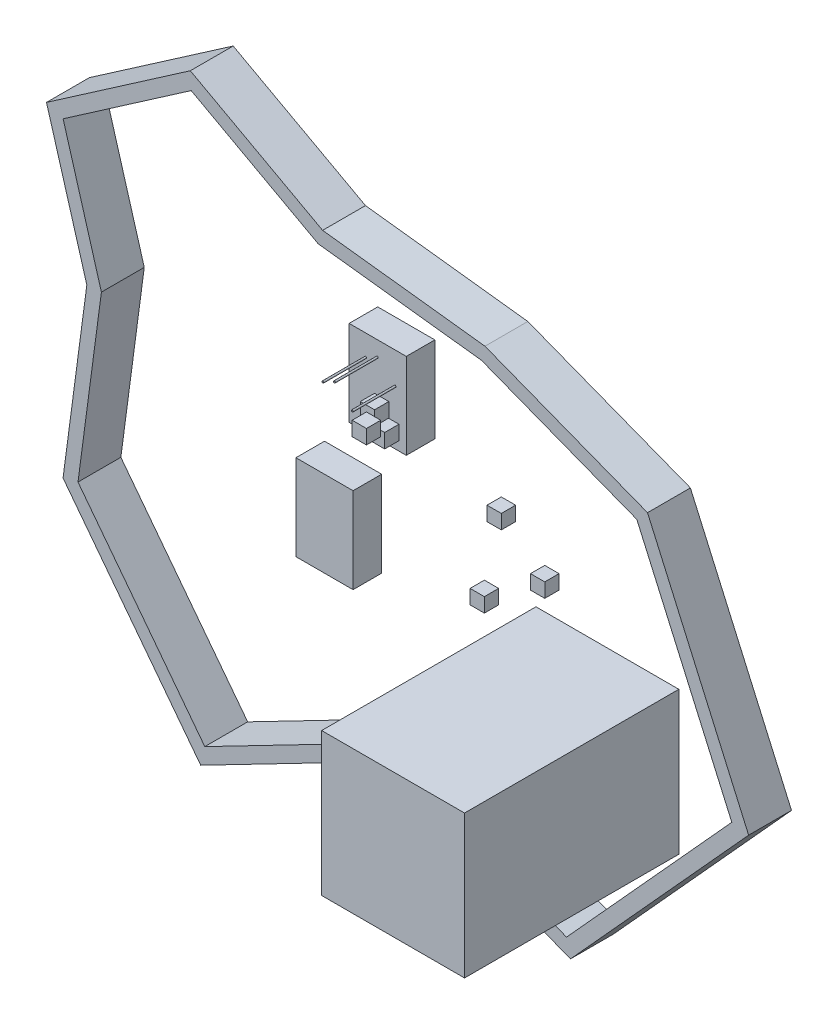
from build123d import *

# Parameters (mm, degrees)
SKETCH2_W                 = 5.08
SKETCH2_H                 = 15.24
SKETCH4_W                 = 20.32
SKETCH4_H                 = 30.48
BOSS_EXTRUDE2_DEPTH       = 10.16
BOSS_EXTRUDE2_2_DEPTH     = 10.16
SKETCH8_W                 = 5.08
SKETCH8_H                 = 5.08
BOSS_EXTRUDE3_DEPTH       = 5.08
BOSS_EXTRUDE3_2_DEPTH     = 5.08
BOSS_EXTRUDE3_3_DEPTH     = 5.08
SKETCH9_R                 = 0.3175
BOSS_EXTRUDE4_DEPTH       = 15.24
BOSS_EXTRUDE5_START       = -50.35078241
BOSS_EXTRUDE5_OUTLINE_W   = 5.08
BOSS_EXTRUDE5_OUTLINE_H   = 5.08
BOSS_EXTRUDE5_DEPTH       = 5.08
BOSS_EXTRUDE5_START_2     = -46.760051942
BOSS_EXTRUDE5_2_OUTLINE_W = 5.08
BOSS_EXTRUDE5_2_OUTLINE_H = 5.08
BOSS_EXTRUDE5_2_DEPTH     = 5.08
SKETCH11_W                = 5.08
SKETCH11_H                = 5.08
BOSS_EXTRUDE6_DEPTH       = 5.08
SKETCH12_W                = 50.8
SKETCH12_H                = 50.8
BOSS_EXTRUDE7_DEPTH       = 76.2
SKETCH13_W                = 2.320192308
SKETCH13_H                = 0.284935898
BOSS_EXTRUDE8_DEPTH       = 2.54


# Read off the part's stored shape, not the designer's step: Boss-Extrude5
with BuildPart() as part:
    # Sweep1: sweep along a path in Sketch1
    with BuildLine(Plane.XY) as sweep1_path:
        Line((-7.257050217, 67.127714508), (47.977165324, 45.759733313))
        Line((47.977165324, 45.759733313), (81.742952966, -30.615262543))
        Line((81.742952966, -30.615262543), (22.980659021, -95.349576464))
        Line((22.980659021, -95.349576464), (-44.345800205, -69.30357399))
        Line((-44.345800205, -69.30357399), (-105.630397604, -100.993948855))
        Line((-105.630397604, -100.993948855), (-150.720654377, -42.085618555))
        Line((-150.720654377, -42.085618555), (-142.397147653, 20.559361376))
        Line((-142.397147653, 20.559361376), (-156.00922127, 67.127714508))
        Line((-156.00922127, 67.127714508), (-110.468431083, 98.574932116))
        Line((-110.468431083, 98.574932116), (-65.313451954, 73.981595269))
        Line((-65.313451954, 73.981595269), (-7.257050217, 67.127714508))
    # Sketch2 → Sweep1 (sweep)
    with BuildSketch(Plane(origin=(22.980659021, -95.349576464, 0), x_dir=(-0.7404356459239746, 0.6721272604538121, 0), z_dir=(-0.6721272604538121, -0.7404356459239746, 0))):
        with Locations((-2.54, -7.62)):
            Rectangle(SKETCH2_W, SKETCH2_H)
    sweep(path=sweep1_path.line, transition=Transition.RIGHT)


with BuildPart() as body_2:
    # Sketch4 → Boss-Extrude2 (new body)
    with BuildSketch(Plane.XY):
        with Locations((-49.234960183, 34.655005926)):
            Rectangle(SKETCH4_W, SKETCH4_H)
    extrude(amount=BOSS_EXTRUDE2_DEPTH)

    # Sketch9 → Boss-Extrude4 (add)
    with BuildSketch(Plane.XY.offset(10.16)):
        with Locations(Location((-53.524881213, 42.375280418, 0), (0, 0, 180))):
            Circle(SKETCH9_R)
        with Locations(Location((-49.395083843, 44.483621336, 0), (0, 0, 180))):
            Circle(SKETCH9_R)
        with Locations(Location((-43.028697146, 38.734466137, 0), (0, 0, 180))):
            Circle(SKETCH9_R)
    extrude(amount=BOSS_EXTRUDE4_DEPTH)

    # Boss-Extrude5 outline → Boss-Extrude5 (add)
    with BuildSketch(Plane.YZ.offset(BOSS_EXTRUDE5_START)):
        with Locations((30.355657961, 12.7)):
            Rectangle(BOSS_EXTRUDE5_OUTLINE_W, BOSS_EXTRUDE5_OUTLINE_H)
    extrude(amount=BOSS_EXTRUDE5_DEPTH)

    # Boss-Extrude5 2 outline → Boss-Extrude5 2 (add)
    with BuildSketch(Plane.YZ.offset(BOSS_EXTRUDE5_START_2)):
        with Locations((25.162270308, 12.7)):
            Rectangle(BOSS_EXTRUDE5_2_OUTLINE_W, BOSS_EXTRUDE5_2_OUTLINE_H)
    extrude(amount=BOSS_EXTRUDE5_2_DEPTH)

    # Sketch11 → Boss-Extrude6 (add)
    with BuildSketch(Plane.XY.offset(15.24)):
        with Locations((-45.619537146, 28.235790272)):
            Rectangle(SKETCH11_W, SKETCH11_H)
    extrude(amount=BOSS_EXTRUDE6_DEPTH)


with BuildPart() as body_3:
    # Sketch4 → Boss-Extrude2 2 (new body)
    with BuildSketch(Plane.XY):
        with Locations((-68.156587581, -16.164579556)):
            Rectangle(SKETCH4_W, SKETCH4_H)
    extrude(amount=BOSS_EXTRUDE2_2_DEPTH)


with BuildPart() as body_4:
    # Sketch8 → Boss-Extrude3 (new body)
    with BuildSketch(Plane.XY):
        with Locations((-12.912976789, 10.811567101)):
            Rectangle(SKETCH8_W, SKETCH8_H)
    extrude(amount=BOSS_EXTRUDE3_DEPTH)


with BuildPart() as body_5:
    # Sketch8 → Boss-Extrude3 2 (new body)
    with BuildSketch(Plane.XY):
        with Locations((2.54, -2.54)):
            Rectangle(SKETCH8_W, SKETCH8_H)
    extrude(amount=BOSS_EXTRUDE3_2_DEPTH)


with BuildPart() as body_6:
    # Sketch8 → Boss-Extrude3 3 (new body)
    with BuildSketch(Plane.XY):
        with Locations((-18.931814109, -17.821007752)):
            Rectangle(SKETCH8_W, SKETCH8_H)
    extrude(amount=BOSS_EXTRUDE3_3_DEPTH)


with BuildPart() as body_7:
    # Sketch12 → Boss-Extrude7 (new body)
    with BuildSketch(Plane.XY):
        with Locations((22.274783409, -39.712298072)):
            Rectangle(SKETCH12_W, SKETCH12_H)
    extrude(amount=BOSS_EXTRUDE7_DEPTH)

    # Sketch13 → Boss-Extrude8 (add)
    # profile 1 of 13: a face of its own
    with BuildSketch(Plane.ZY.offset(3.125216591)):
        with BuildLine():
            Line((52.77321562, -22.209717114), (52.77321562, -22.494653012))
            Line((52.77321562, -22.494653012), (52.369980444, -22.494653012))
            add(Edge.make_bspline(
                [(52.369980444, -22.494653012), (52.405204861, -22.520366248), (52.472583865, -22.569551796), (52.562362323, -22.649432973), (52.637300451, -22.730607346), (52.677154282, -22.788654223), (52.696257487, -22.816477931)],
                knots=[0, 0, 0, 0, 1.134266299, 2.169680534, 3.122669868, 4, 4, 4, 4], degree=3))
            add(Edge.make_bspline(
                [(52.696257487, -22.816477931), (52.714405211, -22.854455161), (52.750383598, -22.929746113), (52.786881183, -23.048962124), (52.809310382, -23.17094986), (52.812377771, -23.253325882), (52.813920748, -23.294763188)],
                knots=[0, 0, 0, 0, 1.014936303, 2.012140481, 3.000054389, 4, 4, 4, 4], degree=3))
            add(Edge.make_bspline(
                [(52.813920748, -23.294763188), (52.812970004, -23.322786528), (52.811088532, -23.378243212), (52.798915092, -23.460430823), (52.777619253, -23.540266697), (52.748708632, -23.617232973), (52.712577896, -23.68930753), (52.671031725, -23.755508871), (52.624102768, -23.815024066), (52.5699739, -23.867756707), (52.507073314, -23.915171048), (52.433718618, -23.958785777), (52.348258589, -23.999085686), (52.286240403, -24.021420746), (52.253589218, -24.033179654)],
                knots=[0, 0, 0, 0, 1.009798505, 1.998336943, 2.985959917, 3.981996858, 4.955664737, 5.886087062, 6.794002107, 7.679958053, 8.601272429, 9.625787331, 10.750030247, 12, 12, 12, 12], degree=3))
            add(Edge.make_bspline(
                [(52.253589218, -24.033179654), (52.276017798, -24.045617718), (52.320154094, -24.070094081), (52.382618379, -24.111192764), (52.441044524, -24.154252842), (52.495478979, -24.199641256), (52.545652606, -24.247197916), (52.591732469, -24.297146215), (52.633912149, -24.349203353), (52.683203918, -24.421581732), (52.735356065, -24.51561456), (52.781160751, -24.634204569), (52.808878193, -24.757812866), (52.812231565, -24.841843013), (52.813920748, -24.884171241)],
                knots=[0, 0, 0, 0, 0.861170869, 1.694663331, 2.509326413, 3.297991968, 4.073691563, 4.829592376, 5.579160782, 6.321830913, 7.768780219, 9.179854006, 10.579417172, 12, 12, 12, 12], degree=3))
            add(Edge.make_bspline(
                [(52.813920748, -24.884171241), (52.812453698, -24.923070853), (52.809582538, -24.999201172), (52.787036887, -25.110033406), (52.748322164, -25.213394901), (52.695495937, -25.309077677), (52.629111964, -25.395401222), (52.550128089, -25.470436731), (52.459102996, -25.533728418), (52.373475977, -25.575074756), (52.297878925, -25.603119317), (52.233466075, -25.620410579), (52.162571452, -25.635686588), (52.085110287, -25.648369575), (52.000808949, -25.657639262), (51.909805397, -25.664506982), (51.812028903, -25.669155249), (51.744568771, -25.6694837), (51.709794146, -25.669653012)],
                knots=[0, 0, 0, 0, 1.209669288, 2.367440248, 3.500751976, 4.631527125, 5.755587489, 6.87532382, 8.007944318, 9.190864318, 9.82315674, 10.514484317, 11.263564316, 12.079023757, 12.955305781, 13.901327259, 14.918167583, 16, 16, 16, 16], degree=3))
            Line((51.709794146, -25.669653012), (50.453023312, -25.669653012))
            Line((50.453023312, -25.669653012), (50.453023312, -25.384717114))
            Line((50.453023312, -25.384717114), (51.711066181, -25.384717114))
            add(Edge.make_bspline(
                [(51.711066181, -25.384717114), (51.740748416, -25.384646463), (51.797793157, -25.384510683), (51.879665024, -25.382067174), (51.954294176, -25.377463139), (52.021578858, -25.372079575), (52.081675965, -25.364601258), (52.134464829, -25.354943891), (52.18036056, -25.344713382), (52.231238945, -25.327717325), (52.287361865, -25.300549213), (52.347898632, -25.259172103), (52.400552519, -25.207021713), (52.446534359, -25.146740311), (52.4831663, -25.077939292), (52.510316951, -25.002429423), (52.526367117, -24.920465382), (52.528097586, -24.863678332), (52.528984851, -24.834561866)],
                knots=[0, 0, 0, 0, 1.253542879, 2.409118771, 3.458568974, 4.411070626, 5.259544058, 6.014735414, 6.677123945, 7.243402448, 8.276608576, 9.299873988, 10.325604302, 11.392892819, 12.490509435, 13.603538441, 14.771260462, 16, 16, 16, 16], degree=3))
            add(Edge.make_bspline(
                [(52.528984851, -24.834561866), (52.527672218, -24.798583048), (52.525070415, -24.727268513), (52.499493063, -24.623338904), (52.459972951, -24.523737892), (52.403548681, -24.431142775), (52.335657573, -24.345856974), (52.254975315, -24.272466633), (52.163687494, -24.211841073), (52.079190654, -24.170789057), (52.003290438, -24.144854505), (51.936980698, -24.127730439), (51.861613841, -24.114410507), (51.777696333, -24.101918669), (51.684650526, -24.093765516), (51.582906834, -24.086355636), (51.472159242, -24.082889567), (51.395390746, -24.082404737), (51.355532327, -24.082153012)],
                knots=[0, 0, 0, 0, 1.090512009, 2.161531735, 3.230072964, 4.332825141, 5.440581378, 6.529496625, 7.62916386, 8.757669174, 9.370357692, 10.061947597, 10.834545503, 11.692923569, 12.636967211, 13.669242667, 14.789864225, 16, 16, 16, 16], degree=3))
            Line((51.355532327, -24.082153012), (50.453023312, -24.082153012))
            Line((50.453023312, -24.082153012), (50.453023312, -23.797217114))
            Line((50.453023312, -23.797217114), (51.632836013, -23.797217114))
            add(Edge.make_bspline(
                [(51.632836013, -23.797217114), (51.666122472, -23.797148287), (51.730162273, -23.797015872), (51.821990717, -23.794545558), (51.905537709, -23.790070922), (51.980593473, -23.784291564), (52.047361971, -23.778018987), (52.105624178, -23.768092463), (52.155622534, -23.757745048), (52.21098928, -23.741953949), (52.271048803, -23.714602514), (52.335564495, -23.672998043), (52.392422168, -23.621313691), (52.440637182, -23.559906895), (52.480158222, -23.490566382), (52.509073459, -23.414277697), (52.525751202, -23.3315228), (52.52788664, -23.274486408), (52.528984851, -23.245153813)],
                knots=[0, 0, 0, 0, 1.320226356, 2.539982809, 3.643122147, 4.638255983, 5.52602392, 6.301561104, 6.98107216, 7.550523949, 8.58191082, 9.584830316, 10.584890324, 11.614493144, 12.668965657, 13.738783174, 14.837104585, 16, 16, 16, 16], degree=3))
            add(Edge.make_bspline(
                [(52.528984851, -23.245153813), (52.527596505, -23.210667678), (52.524829581, -23.141938037), (52.499924633, -23.040971247), (52.460913792, -22.943466391), (52.406793821, -22.85097886), (52.339756769, -22.766003229), (52.260912657, -22.691609259), (52.171242026, -22.629071395), (52.087637063, -22.587576819), (52.013635306, -22.560838053), (51.950735216, -22.542989487), (51.88080381, -22.52802171), (51.803994102, -22.515334739), (51.720146673, -22.505787974), (51.62949849, -22.500076198), (51.531763256, -22.495055467), (51.464299025, -22.494790454), (51.429310372, -22.494653012)],
                knots=[0, 0, 0, 0, 1.098813768, 2.189896819, 3.297771711, 4.440532809, 5.596253211, 6.739894833, 7.8864334, 9.072265856, 9.705655743, 10.395080422, 11.156654178, 11.986235968, 12.878145268, 13.847797945, 14.883813667, 16, 16, 16, 16], degree=3))
            Line((51.429310372, -22.494653012), (50.453023312, -22.494653012))
            Line((50.453023312, -22.494653012), (50.453023312, -22.209717114))
            Line((50.453023312, -22.209717114), (52.77321562, -22.209717114))
        make_face()
    # profile 2 of 13: a face of its own
    with BuildSketch(Plane.ZY.offset(3.125216591)):
        with BuildLine():
            Line((52.77321562, -28.681832499), (50.453023312, -28.681832499))
            Line((50.453023312, -28.681832499), (50.453023312, -28.396896601))
            Line((50.453023312, -28.396896601), (50.854350436, -28.396896601))
            add(Edge.make_bspline(
                [(50.854350436, -28.396896601), (50.818019001, -28.364773417), (50.747117748, -28.302084619), (50.654767191, -28.197400346), (50.577804144, -28.086896632), (50.516221101, -27.970199804), (50.469609943, -27.847659016), (50.436831625, -27.719623723), (50.415493836, -27.586264565), (50.413386232, -27.495318217), (50.412318184, -27.449230335)],
                knots=[0, 0, 0, 0, 1.074295371, 2.096500925, 3.086030275, 4.053105238, 5.014108356, 5.985331429, 6.979048527, 8, 8, 8, 8], degree=3))
            add(Edge.make_bspline(
                [(50.412318184, -27.449230335), (50.413430494, -27.408256437), (50.415624019, -27.327454096), (50.432646764, -27.208593606), (50.45996974, -27.09420401), (50.49801591, -26.984212407), (50.54822244, -26.87936408), (50.608979275, -26.779068235), (50.680622317, -26.683090801), (50.762844508, -26.593257067), (50.852055046, -26.510428138), (50.947483244, -26.437961191), (51.0478184, -26.376543094), (51.153032312, -26.326068419), (51.263048069, -26.287008468), (51.377790199, -26.259833311), (51.497067777, -26.242828911), (51.578293262, -26.240636497), (51.619479643, -26.239524806)],
                knots=[0, 0, 0, 0, 1.034036272, 2.039165313, 3.024406509, 3.999331371, 4.971254918, 5.953351348, 6.95522652, 7.989525907, 9.023492927, 10.024309745, 11.009187477, 11.988246066, 12.964946762, 13.950187958, 14.960617622, 16, 16, 16, 16], degree=3))
            add(Edge.make_bspline(
                [(51.619479643, -26.239524806), (51.659814746, -26.240661154), (51.739555068, -26.242907651), (51.856826831, -26.259651358), (51.969791854, -26.287786145), (52.078031673, -26.327344984), (52.181982205, -26.377846501), (52.28083014, -26.44032085), (52.376087572, -26.512761683), (52.464699765, -26.596475844), (52.546254878, -26.687115869), (52.618072026, -26.783630287), (52.678673087, -26.884815661), (52.727935857, -26.990874882), (52.767083054, -27.101056956), (52.794372419, -27.216198879), (52.810414197, -27.33577703), (52.812740667, -27.416956837), (52.813920748, -27.458134582)],
                knots=[0, 0, 0, 0, 1.02050356, 2.017480486, 2.990790918, 3.96161403, 4.928589988, 5.909588639, 6.91611943, 7.952353252, 8.989586576, 9.99823133, 10.991940466, 11.968822692, 12.952985106, 13.945868367, 14.958059758, 16, 16, 16, 16], degree=3))
            add(Edge.make_bspline(
                [(52.813920748, -27.458134582), (52.812622853, -27.505489155), (52.810077741, -27.598349236), (52.788672056, -27.734350258), (52.752953217, -27.863126589), (52.703862475, -27.985420512), (52.639111378, -28.10075762), (52.556693271, -28.207718421), (52.458490994, -28.308456208), (52.382842114, -28.366843292), (52.343903721, -28.396896601)],
                knots=[0, 0, 0, 0, 1.03879612, 2.037030165, 3.012306674, 3.966139504, 4.922386257, 5.905048148, 6.921675258, 8, 8, 8, 8], degree=3))
            Line((52.343903721, -28.396896601), (52.77321562, -28.396896601))
            Line((52.77321562, -28.396896601), (52.77321562, -28.681832499))
        make_face()
        with BuildLine():
            add(Edge.make_bspline(
                [(52.528984851, -27.461950688), (52.527502924, -27.420299799), (52.524577836, -27.33808757), (52.501741649, -27.217398016), (52.463747205, -27.1019052), (52.411781078, -26.992194956), (52.346452813, -26.889969786), (52.26737656, -26.798696522), (52.17706697, -26.717283175), (52.074764766, -26.649972024), (51.966342553, -26.593222026), (51.852144175, -26.554305618), (51.735337827, -26.528409377), (51.656082295, -26.525780355), (51.616299554, -26.524460704)],
                knots=[0, 0, 0, 0, 1.031093775, 2.03521511, 3.029845951, 4.035119871, 5.034286494, 6.024708811, 7.017619509, 8.03559408, 9.050082311, 10.039808432, 11.016071318, 12, 12, 12, 12], degree=3))
            add(Edge.make_bspline(
                [(51.616299554, -26.524460704), (51.576762394, -26.526168023), (51.497843047, -26.52957597), (51.380689651, -26.553623012), (51.266951005, -26.595288383), (51.157026907, -26.650743056), (51.054514716, -26.719564048), (50.962439132, -26.800301718), (50.883045749, -26.892738883), (50.816593463, -26.995185788), (50.763102533, -27.104437697), (50.725383757, -27.219383258), (50.701566382, -27.33800284), (50.69869635, -27.418802568), (50.697254082, -27.459406617)],
                knots=[0, 0, 0, 0, 0.979154363, 1.954470772, 2.947816011, 3.971783346, 4.997163654, 5.998045606, 6.995988793, 8.00538986, 9.015323546, 10.000094788, 10.994993517, 12, 12, 12, 12], degree=3))
            add(Edge.make_bspline(
                [(50.697254082, -27.459406617), (50.698737355, -27.500637986), (50.701679934, -27.582434527), (50.724898031, -27.703408141), (50.762420064, -27.820987402), (50.815129972, -27.933423281), (50.880156174, -28.038088019), (50.956618249, -28.131906645), (51.044798063, -28.212017158), (51.142487672, -28.279174988), (51.249081426, -28.332226307), (51.36305467, -28.369644089), (51.483511739, -28.392625598), (51.565950885, -28.395453248), (51.608031325, -28.396896601)],
                knots=[0, 0, 0, 0, 1.017484689, 2.018529338, 3.030031036, 4.058138743, 5.076350332, 6.065651025, 7.036469986, 8.00785331, 8.984076697, 9.96571663, 10.961615403, 12, 12, 12, 12], degree=3))
            add(Edge.make_bspline(
                [(51.608031325, -28.396896601), (51.640087773, -28.396026042), (51.703185008, -28.394312506), (51.795829433, -28.381222115), (51.884487237, -28.360397997), (51.96925546, -28.33105802), (52.049651325, -28.292502616), (52.126305023, -28.246050274), (52.198502535, -28.19074819), (52.266152431, -28.128279345), (52.327547264, -28.059130539), (52.381660155, -27.985599745), (52.427454551, -27.907871967), (52.464102046, -27.826001765), (52.493957841, -27.740619709), (52.513677078, -27.650907429), (52.527260589, -27.557769058), (52.528404045, -27.494226434), (52.528984851, -27.461950688)],
                knots=[0, 0, 0, 0, 1.050062701, 2.066855696, 3.059271411, 4.030305351, 4.999747758, 5.975466543, 6.961907836, 7.974539719, 8.98812422, 9.98710676, 10.961662635, 11.93785114, 12.922015094, 13.919620009, 14.94329489, 16, 16, 16, 16], degree=3))
        make_face(mode=Mode.SUBTRACT)
    # profile 3 of 13: a face of its own
    with BuildSketch(Plane.ZY.offset(3.125216591)):
        Polygon((52.77321562, -29.129588909), (52.77321562, -29.468586305), (51.936216421, -30.065806858), (52.77321562, -30.663027411), (52.77321562, -31.002024806), (51.698981846, -30.235623564), (50.453023312, -31.124140191), (50.453023312, -30.785142795), (51.461111253, -30.065806858), (50.453023312, -29.34647092), (50.453023312, -29.007473524), (51.698981846, -29.896626169), align=None)
    # profile 4 of 13: a face of its own
    with BuildSketch(Plane.ZY.offset(3.125216591)):
        with BuildLine():
            Line((52.77321562, -32.589524806), (52.77321562, -32.874460704))
            Line((52.77321562, -32.874460704), (52.431674154, -32.874460704))
            add(Edge.make_bspline(
                [(52.431674154, -32.874460704), (52.463478125, -32.895493694), (52.524302973, -32.935719123), (52.604695527, -33.00262007), (52.671555222, -33.071126176), (52.724229198, -33.142089401), (52.764000445, -33.21491652), (52.793376355, -33.288396525), (52.81045184, -33.364051581), (52.812762897, -33.414993979), (52.813920748, -33.440516393)],
                knots=[0, 0, 0, 0, 1.280622107, 2.44917983, 3.507334186, 4.490567186, 5.408878616, 6.288712897, 7.142636019, 8, 8, 8, 8], degree=3))
            add(Edge.make_bspline(
                [(52.813920748, -33.440516393), (52.812864931, -33.460322404), (52.810703515, -33.500868274), (52.794757396, -33.562432535), (52.770264565, -33.626124136), (52.746668404, -33.667225598), (52.734418545, -33.688563268)],
                knots=[0, 0, 0, 0, 0.90119973, 1.844890732, 2.881183062, 4, 4, 4, 4], degree=3))
            Line((52.734418545, -33.688563268), (52.487643705, -33.532102931))
            add(Edge.make_bspline(
                [(52.487643705, -33.532102931), (52.493758089, -33.518396891), (52.505364361, -33.492380202), (52.519100327, -33.454321417), (52.527188337, -33.419231919), (52.528413631, -33.396876691), (52.528984851, -33.386454895)],
                knots=[0, 0, 0, 0, 1.180555205, 2.24091978, 3.179933427, 4, 4, 4, 4], degree=3))
            add(Edge.make_bspline(
                [(52.528984851, -33.386454895), (52.527516854, -33.363359927), (52.52454931, -33.316673642), (52.499557278, -33.248229488), (52.460876394, -33.181512879), (52.416451016, -33.129202522), (52.374432284, -33.088389093), (52.337538738, -33.059248132), (52.296197996, -33.032498853), (52.251084442, -33.006945666), (52.201437128, -32.983662312), (52.147749361, -32.961932109), (52.089959748, -32.942284396), (52.049698456, -32.931080965), (52.029074995, -32.925342114)],
                knots=[0, 0, 0, 0, 1.135927944, 2.296268816, 3.551388088, 4.924624343, 5.663947748, 6.437790805, 7.238014523, 8.089896346, 8.992356783, 9.939655789, 10.944608424, 12, 12, 12, 12], degree=3))
            add(Edge.make_bspline(
                [(52.029074995, -32.925342114), (52.010680702, -32.921049157), (51.96993874, -32.911540584), (51.901586864, -32.902295403), (51.820829688, -32.893160912), (51.727442422, -32.886723265), (51.621658276, -32.880756041), (51.503316097, -32.877390467), (51.372294414, -32.874575475), (51.280696251, -32.874500122), (51.232780925, -32.874460704)],
                knots=[0, 0, 0, 0, 0.566838948, 1.255505196, 2.06880316, 3.007127437, 4.065329342, 5.249902469, 6.561414163, 8, 8, 8, 8], degree=3))
            Line((51.232780925, -32.874460704), (50.453023312, -32.874460704))
            Line((50.453023312, -32.874460704), (50.453023312, -32.589524806))
            Line((50.453023312, -32.589524806), (52.77321562, -32.589524806))
        make_face()
    # profile 5 of 13: a face of its own
    with BuildSketch(Plane.ZY.offset(3.125216591)):
        with BuildLine():
            add(Edge.make_bspline(
                [(52.813920748, -35.134867355), (52.812996467, -35.178403376), (52.811184179, -35.263766873), (52.791719223, -35.388763009), (52.76220186, -35.50795589), (52.720652332, -35.621856819), (52.666137729, -35.729523603), (52.600213351, -35.831917531), (52.522433184, -35.928833453), (52.462231868, -35.986909064), (52.431674154, -36.016387787)],
                knots=[0, 0, 0, 0, 1.054042676, 2.066720093, 3.05716247, 4.025731183, 4.997454851, 5.974904663, 6.97207755, 8, 8, 8, 8], degree=3))
            add(Edge.make_bspline(
                [(52.431674154, -36.016387787), (52.402451467, -36.041771417), (52.344571632, -36.092047433), (52.250722612, -36.156514193), (52.153531235, -36.212050894), (52.051706874, -36.256558008), (51.946138422, -36.291650851), (51.836463026, -36.316566161), (51.722922897, -36.331386095), (51.645812273, -36.333384501), (51.60675929, -36.334396601)],
                knots=[0, 0, 0, 0, 1.025258237, 2.030674902, 3.01204498, 3.988269485, 4.97094183, 5.956517959, 6.965070386, 8, 8, 8, 8], degree=3))
            add(Edge.make_bspline(
                [(51.60675929, -36.334396601), (51.567479952, -36.333506388), (51.489862148, -36.331747286), (51.375544581, -36.315107005), (51.264696417, -36.289225235), (51.157781757, -36.252184919), (51.054473718, -36.204688655), (50.955223802, -36.146730595), (50.859835123, -36.077904504), (50.769121773, -35.999885414), (50.685504142, -35.913664179), (50.612670082, -35.820107183), (50.550007812, -35.720985153), (50.500236547, -35.614944978), (50.46011744, -35.503496104), (50.432452734, -35.385929647), (50.415576513, -35.262350488), (50.413419572, -35.177959481), (50.412318184, -35.134867355)],
                knots=[0, 0, 0, 0, 0.998669827, 1.973418153, 2.932281609, 3.89081133, 4.846438734, 5.82045571, 6.809776312, 7.834649874, 8.860672198, 9.859676908, 10.845817165, 11.837296335, 12.833502054, 13.853824644, 14.904110009, 16, 16, 16, 16], degree=3))
            add(Edge.make_bspline(
                [(50.412318184, -35.134867355), (50.413428684, -35.091566175), (50.415603655, -35.006758627), (50.432327199, -34.882714139), (50.460413026, -34.764652691), (50.499739881, -34.652676639), (50.550416618, -34.546636893), (50.612426269, -34.447148854), (50.685541023, -34.353547728), (50.76911178, -34.267299461), (50.859837698, -34.189287619), (50.955223133, -34.120459658), (51.054473892, -34.062502084), (51.157781711, -34.015005692), (51.26469643, -33.97796541), (51.375544578, -33.952083632), (51.489862149, -33.935443353), (51.567479952, -33.93368425), (51.60675929, -33.932794037)],
                knots=[0, 0, 0, 0, 1.099861214, 2.154133753, 3.1731438, 4.178222029, 5.163564916, 6.153006591, 7.15072618, 8.175428628, 9.198983792, 10.187031731, 11.15979573, 12.114193814, 13.071490482, 14.029120454, 15.002614863, 16, 16, 16, 16], degree=3))
            add(Edge.make_bspline(
                [(51.60675929, -33.932794037), (51.645600014, -33.93381304), (51.722497972, -33.935830491), (51.835824662, -33.950635524), (51.945314437, -33.975453643), (52.050475404, -34.010588553), (52.15185355, -34.055505905), (52.249285075, -34.110262216), (52.342709723, -34.175386575), (52.400514752, -34.225462631), (52.429766101, -34.250802851)],
                knots=[0, 0, 0, 0, 1.031353054, 2.041901799, 3.029428768, 4.008703097, 4.981709435, 5.96992636, 6.972712378, 8, 8, 8, 8], degree=3))
            add(Edge.make_bspline(
                [(52.429766101, -34.250802851), (52.460583672, -34.280239572), (52.521191847, -34.338132062), (52.59881855, -34.43549536), (52.665631747, -34.537448825), (52.720118915, -34.645810098), (52.762126472, -34.760027736), (52.791856989, -34.880106482), (52.81109808, -35.005557579), (52.812970482, -35.091334534), (52.813920748, -35.134867355)],
                knots=[0, 0, 0, 0, 1.027951202, 2.021646915, 2.998468564, 3.9668038, 4.943370589, 5.93035926, 6.949632805, 8, 8, 8, 8], degree=3))
        make_face()
        with BuildLine():
            add(Edge.make_bspline(
                [(52.528984851, -35.133595319), (52.528109781, -35.102809092), (52.526382231, -35.042031379), (52.513243943, -34.952568829), (52.492424754, -34.866446391), (52.462857525, -34.783489681), (52.424632676, -34.704019548), (52.377947705, -34.627948552), (52.322553964, -34.555481068), (52.259552456, -34.487173802), (52.191121769, -34.423748733), (52.117537875, -34.368944481), (52.040911752, -34.322257363), (51.960845654, -34.283405005), (51.876581317, -34.254457992), (51.789058963, -34.233437465), (51.698104079, -34.220310697), (51.636272274, -34.218599508), (51.604851237, -34.217729935)],
                knots=[0, 0, 0, 0, 1.021589593, 2.016807015, 2.994807536, 3.958602519, 4.934347097, 5.916793557, 6.916107818, 7.957073844, 8.998039869, 10.008589932, 10.997041759, 11.972786337, 12.956492182, 13.948170289, 14.957322718, 16, 16, 16, 16], degree=3))
            add(Edge.make_bspline(
                [(51.604851237, -34.217729935), (51.564252961, -34.219183707), (51.483672976, -34.222069173), (51.36503498, -34.245652697), (51.250925052, -34.28482603), (51.142717104, -34.338843433), (51.042425631, -34.405367489), (50.952243066, -34.483153729), (50.87564721, -34.573277574), (50.811228805, -34.672670136), (50.760499372, -34.779922895), (50.724119622, -34.893237712), (50.700788979, -35.011582823), (50.698442693, -35.092568542), (50.697254082, -35.133595319)],
                knots=[0, 0, 0, 0, 1.016977094, 2.018509362, 3.018404954, 4.033172147, 5.041280572, 6.028085189, 7.007940189, 7.995502847, 8.989109012, 9.972200833, 10.97273166, 12, 12, 12, 12], degree=3))
            add(Edge.make_bspline(
                [(50.697254082, -35.133595319), (50.698435808, -35.174624457), (50.700768502, -35.255614834), (50.724237823, -35.374124607), (50.76034118, -35.487749984), (50.811286101, -35.595114258), (50.875403725, -35.694552083), (50.952679426, -35.784032383), (51.042188558, -35.862488507), (51.142584124, -35.929078434), (51.251093275, -35.982225467), (51.365013955, -36.02158302), (51.48367833, -36.045109985), (51.564254755, -36.048003085), (51.604851237, -36.049460704)],
                knots=[0, 0, 0, 0, 1.027082318, 2.027431966, 3.015401697, 4.008827937, 4.996211763, 5.971861488, 6.96198607, 7.969911943, 8.982141629, 9.981856156, 10.983207064, 12, 12, 12, 12], degree=3))
            add(Edge.make_bspline(
                [(51.604851237, -36.049460704), (51.636274783, -36.0485976), (51.698111525, -36.046899144), (51.789030499, -36.033679768), (51.876754424, -36.012985775), (51.960506074, -35.982771164), (52.0413028, -35.945252242), (52.117307779, -35.897429406), (52.191168547, -35.842880421), (52.25951121, -35.779338969), (52.322784157, -35.711039393), (52.377745918, -35.638027493), (52.424659336, -35.561921167), (52.462862232, -35.482425919), (52.492310949, -35.399656937), (52.513334635, -35.313795971), (52.526334328, -35.224729603), (52.528095692, -35.164167707), (52.528984851, -35.133595319)],
                knots=[0, 0, 0, 0, 1.043020522, 2.052505155, 3.044509714, 4.030878336, 5.003918577, 5.996372628, 7.007255355, 8.048564058, 9.08987276, 10.095126797, 11.077896669, 12.053962454, 13.01807471, 13.98956039, 14.985105429, 16, 16, 16, 16], degree=3))
        make_face(mode=Mode.SUBTRACT)
    # profile 6 of 13: a face of its own
    with BuildSketch(Plane.ZY.offset(3.125216591)):
        with BuildLine():
            Line((50.453023312, -36.904268396), (53.709433569, -36.904268396))
            Line((53.709433569, -36.904268396), (53.709433569, -37.189204294))
            Line((53.709433569, -37.189204294), (52.35217195, -37.189204294))
            add(Edge.make_bspline(
                [(52.35217195, -37.189204294), (52.389221007, -37.221028518), (52.461727613, -37.283309903), (52.555000889, -37.388944664), (52.635824493, -37.498597638), (52.700805683, -37.614968968), (52.751670293, -37.737037942), (52.787795045, -37.864674334), (52.810253145, -37.998273095), (52.812684017, -38.089291827), (52.813920748, -38.135598524)],
                knots=[0, 0, 0, 0, 1.073845349, 2.101561798, 3.093746447, 4.06731023, 5.027507813, 5.99794647, 6.981435071, 8, 8, 8, 8], degree=3))
            add(Edge.make_bspline(
                [(52.813920748, -38.135598524), (52.812798223, -38.176571623), (52.810578801, -38.257582421), (52.79363796, -38.376660225), (52.766407431, -38.491100437), (52.727941796, -38.600927873), (52.678033994, -38.706083261), (52.617440264, -38.806934173), (52.545596939, -38.902997811), (52.463398245, -38.992843612), (52.374188513, -39.075685879), (52.278734467, -39.148089706), (52.178740689, -39.209593278), (52.073549535, -39.259069436), (51.964453595, -39.299440037), (51.849890823, -39.326109758), (51.730882314, -39.343337602), (51.649858154, -39.345484603), (51.608667343, -39.346576088)],
                knots=[0, 0, 0, 0, 1.034424137, 2.045232812, 3.030843571, 4.001080581, 4.978206309, 5.965255608, 6.967506581, 8.002193933, 9.036548792, 10.037741014, 11.022988172, 11.995276286, 12.96911093, 13.954721688, 14.960227752, 16, 16, 16, 16], degree=3))
            add(Edge.make_bspline(
                [(51.608667343, -39.346576088), (51.568118041, -39.34545446), (51.488161204, -39.343242786), (51.370498828, -39.326350599), (51.257252294, -39.298459345), (51.148714232, -39.258580272), (51.044374739, -39.208447077), (50.945423229, -39.145753277), (50.850137873, -39.073353299), (50.761579293, -38.989595757), (50.679724709, -38.898959891), (50.608599388, -38.8019734), (50.547170286, -38.701079228), (50.49849713, -38.594704833), (50.459126295, -38.484425253), (50.431805246, -38.369059009), (50.415863975, -38.249258795), (50.413509425, -38.167870946), (50.412318184, -38.126694278)],
                knots=[0, 0, 0, 0, 1.024244038, 2.01964794, 2.996620209, 3.965911562, 4.936179293, 5.91563013, 6.920572822, 7.955171681, 8.990768464, 10.002129126, 10.989675881, 11.969873457, 12.952483066, 13.943799762, 14.959703725, 16, 16, 16, 16], degree=3))
            add(Edge.make_bspline(
                [(50.412318184, -38.126694278), (50.413623021, -38.07955376), (50.41618158, -37.987119424), (50.437454215, -37.851917785), (50.473457778, -37.724087982), (50.522322312, -37.602192723), (50.588151956, -37.487598357), (50.669353213, -37.379176257), (50.768364157, -37.27873438), (50.843693999, -37.219558941), (50.882335211, -37.189204294)],
                knots=[0, 0, 0, 0, 1.035884751, 2.031189381, 2.999123778, 3.950239786, 4.910390163, 5.895605504, 6.920529319, 8, 8, 8, 8], degree=3))
            Line((50.882335211, -37.189204294), (50.453023312, -37.189204294))
            Line((50.453023312, -37.189204294), (50.453023312, -36.904268396))
        make_face()
        with BuildLine():
            add(Edge.make_bspline(
                [(50.697254082, -38.124150207), (50.698736032, -38.165801059), (50.701661168, -38.248013216), (50.724497008, -38.368703303), (50.762492755, -38.484194114), (50.814453981, -38.593911898), (50.879800421, -38.696109105), (50.958809453, -38.787485793), (51.049329662, -38.868471611), (51.150530533, -38.93719391), (51.259486863, -38.992673888), (51.373234053, -39.031753781), (51.489835237, -39.057736422), (51.568884056, -39.060333265), (51.608667343, -39.061640191)],
                knots=[0, 0, 0, 0, 1.031861621, 2.036730714, 3.032102247, 4.038124785, 5.038035477, 6.029195352, 7.02284546, 8.040167683, 9.05302878, 10.043491941, 11.015338596, 12, 12, 12, 12], degree=3))
            add(Edge.make_bspline(
                [(51.608667343, -39.061640191), (51.648419635, -39.059943455), (51.727765517, -39.056556758), (51.845226199, -39.032409874), (51.95939994, -38.991582815), (52.069402823, -38.936039627), (52.171534218, -38.866471593), (52.263819261, -38.785833982), (52.343214312, -38.693364317), (52.409436027, -38.591030425), (52.463462569, -38.482006334), (52.500515494, -38.367262177), (52.524770679, -38.249189926), (52.527572983, -38.169002618), (52.528984851, -38.12860233)],
                knots=[0, 0, 0, 0, 0.984698701, 1.96546623, 2.957354799, 3.98164001, 5.010280354, 6.011473015, 7.009725998, 8.019440419, 9.024964737, 10.015029379, 10.999924227, 12, 12, 12, 12], degree=3))
            add(Edge.make_bspline(
                [(52.528984851, -38.12860233), (52.527573737, -38.087356868), (52.524772962, -38.005492993), (52.5004734, -37.88468948), (52.463234187, -37.766707013), (52.40978712, -37.653947061), (52.344327335, -37.548900116), (52.267705505, -37.454843839), (52.179461718, -37.374525602), (52.081316442, -37.307665506), (51.974823036, -37.254963292), (51.861700007, -37.216033815), (51.74163308, -37.193611244), (51.659428608, -37.190691152), (51.61757159, -37.189204294)],
                knots=[0, 0, 0, 0, 1.0169775, 2.018493981, 3.029491472, 4.064042901, 5.08895728, 6.077764832, 7.048099865, 8.023317454, 8.999054219, 9.971953187, 10.967355531, 12, 12, 12, 12], degree=3))
            add(Edge.make_bspline(
                [(51.61757159, -37.189204294), (51.585515128, -37.190074838), (51.522417866, -37.191788345), (51.429773638, -37.204878948), (51.341115114, -37.225702292), (51.256349509, -37.255045082), (51.17594391, -37.293590028), (51.099326898, -37.340081784), (51.026874566, -37.395321383), (50.959670335, -37.458482646), (50.898205984, -37.52733359), (50.844240017, -37.600870458), (50.799135113, -37.678621324), (50.761953505, -37.760224754), (50.732313774, -37.845496738), (50.712552843, -37.935189178), (50.698980707, -38.028332961), (50.697835683, -38.09187484), (50.697254082, -38.124150207)],
                knots=[0, 0, 0, 0, 1.050410851, 2.067540964, 3.060285716, 4.031641603, 5.001405429, 5.977447716, 6.964216063, 7.981915705, 8.995836261, 9.985438752, 10.966317358, 11.93650433, 12.920994585, 13.918930257, 14.942944538, 16, 16, 16, 16], degree=3))
        make_face(mode=Mode.SUBTRACT)
    # profile 7 of 13: a face of its own
    with BuildSketch(Plane.ZY.offset(3.125216591)):
        with BuildLine():
            add(Edge.make_bspline(
                [(52.813920748, -41.037110944), (52.812996467, -41.080646965), (52.811184179, -41.166010463), (52.791719223, -41.291006599), (52.76220186, -41.41019948), (52.720652332, -41.524100408), (52.666137729, -41.631767193), (52.600213351, -41.734161121), (52.522433184, -41.831077042), (52.462231868, -41.889152654), (52.431674154, -41.918631377)],
                knots=[0, 0, 0, 0, 1.054042676, 2.066720093, 3.05716247, 4.025731183, 4.997454851, 5.974904663, 6.97207755, 8, 8, 8, 8], degree=3))
            add(Edge.make_bspline(
                [(52.431674154, -41.918631377), (52.402451467, -41.944015007), (52.344571632, -41.994291023), (52.250722612, -42.058757782), (52.153531235, -42.114294483), (52.051706874, -42.158801598), (51.946138422, -42.193894441), (51.836463026, -42.218809751), (51.722922897, -42.233629685), (51.645812273, -42.235628091), (51.60675929, -42.236640191)],
                knots=[0, 0, 0, 0, 1.025258237, 2.030674902, 3.01204498, 3.988269485, 4.97094183, 5.956517959, 6.965070386, 8, 8, 8, 8], degree=3))
            add(Edge.make_bspline(
                [(51.60675929, -42.236640191), (51.567479952, -42.235749978), (51.489862148, -42.233990875), (51.375544581, -42.217350594), (51.264696417, -42.191468825), (51.157781757, -42.154428509), (51.054473718, -42.106932245), (50.955223802, -42.048974185), (50.859835123, -41.980148094), (50.769121773, -41.902129004), (50.685504142, -41.815907769), (50.612670082, -41.722350772), (50.550007812, -41.623228743), (50.500236547, -41.517188567), (50.46011744, -41.405739694), (50.432452734, -41.288173237), (50.415576513, -41.164594077), (50.413419572, -41.080203071), (50.412318184, -41.037110944)],
                knots=[0, 0, 0, 0, 0.998669827, 1.973418153, 2.932281609, 3.89081133, 4.846438734, 5.82045571, 6.809776312, 7.834649874, 8.860672198, 9.859676908, 10.845817165, 11.837296335, 12.833502054, 13.853824644, 14.904110009, 16, 16, 16, 16], degree=3))
            add(Edge.make_bspline(
                [(50.412318184, -41.037110944), (50.413428684, -40.993809765), (50.415603655, -40.909002216), (50.432327199, -40.784957729), (50.460413026, -40.666896281), (50.499739881, -40.554920229), (50.550416618, -40.448880483), (50.612426269, -40.349392444), (50.685541023, -40.255791318), (50.76911178, -40.169543051), (50.859837698, -40.091531209), (50.955223133, -40.022703247), (51.054473892, -39.964745673), (51.157781711, -39.917249282), (51.26469643, -39.880209), (51.375544578, -39.854327222), (51.489862149, -39.837686943), (51.567479952, -39.83592784), (51.60675929, -39.835037627)],
                knots=[0, 0, 0, 0, 1.099861214, 2.154133753, 3.1731438, 4.178222029, 5.163564916, 6.153006591, 7.15072618, 8.175428628, 9.198983792, 10.187031731, 11.15979573, 12.114193814, 13.071490482, 14.029120454, 15.002614863, 16, 16, 16, 16], degree=3))
            add(Edge.make_bspline(
                [(51.60675929, -39.835037627), (51.645600014, -39.83605663), (51.722497972, -39.838074081), (51.835824662, -39.852879114), (51.945314437, -39.877697233), (52.050475404, -39.912832143), (52.15185355, -39.957749494), (52.249285075, -40.012505806), (52.342709723, -40.077630165), (52.400514752, -40.127706221), (52.429766101, -40.153046441)],
                knots=[0, 0, 0, 0, 1.031353054, 2.041901799, 3.029428768, 4.008703097, 4.981709435, 5.96992636, 6.972712378, 8, 8, 8, 8], degree=3))
            add(Edge.make_bspline(
                [(52.429766101, -40.153046441), (52.460583672, -40.182483161), (52.521191847, -40.240375651), (52.59881855, -40.33773895), (52.665631747, -40.439692415), (52.720118915, -40.548053687), (52.762126472, -40.662271325), (52.791856989, -40.782350072), (52.81109808, -40.907801169), (52.812970482, -40.993578124), (52.813920748, -41.037110944)],
                knots=[0, 0, 0, 0, 1.027951202, 2.021646915, 2.998468564, 3.9668038, 4.943370589, 5.93035926, 6.949632805, 8, 8, 8, 8], degree=3))
        make_face()
        with BuildLine():
            add(Edge.make_bspline(
                [(52.528984851, -41.035838909), (52.528109781, -41.005052682), (52.526382231, -40.944274969), (52.513243943, -40.854812418), (52.492424754, -40.768689981), (52.462857525, -40.685733271), (52.424632676, -40.606263138), (52.377947705, -40.530192142), (52.322553964, -40.457724657), (52.259552456, -40.389417392), (52.191121769, -40.325992323), (52.117537875, -40.271188071), (52.040911752, -40.224500953), (51.960845654, -40.185648595), (51.876581317, -40.156701582), (51.789058963, -40.135681055), (51.698104079, -40.122554286), (51.636272274, -40.120843098), (51.604851237, -40.119973524)],
                knots=[0, 0, 0, 0, 1.021589593, 2.016807015, 2.994807536, 3.958602519, 4.934347097, 5.916793557, 6.916107818, 7.957073844, 8.998039869, 10.008589932, 10.997041759, 11.972786337, 12.956492182, 13.948170289, 14.957322718, 16, 16, 16, 16], degree=3))
            add(Edge.make_bspline(
                [(51.604851237, -40.119973524), (51.564252961, -40.121427297), (51.483672976, -40.124312763), (51.36503498, -40.147896287), (51.250925052, -40.18706962), (51.142717104, -40.241087022), (51.042425631, -40.307611078), (50.952243066, -40.385397318), (50.87564721, -40.475521164), (50.811228805, -40.574913726), (50.760499372, -40.682166485), (50.724119622, -40.795481302), (50.700788979, -40.913826412), (50.698442693, -40.994812131), (50.697254082, -41.035838909)],
                knots=[0, 0, 0, 0, 1.016977094, 2.018509362, 3.018404954, 4.033172147, 5.041280572, 6.028085189, 7.007940189, 7.995502847, 8.989109012, 9.972200833, 10.97273166, 12, 12, 12, 12], degree=3))
            add(Edge.make_bspline(
                [(50.697254082, -41.035838909), (50.698435808, -41.076868046), (50.700768502, -41.157858424), (50.724237823, -41.276368196), (50.76034118, -41.389993573), (50.811286101, -41.497357848), (50.875403725, -41.596795673), (50.952679426, -41.686275972), (51.042188558, -41.764732097), (51.142584124, -41.831322024), (51.251093275, -41.884469056), (51.365013955, -41.92382661), (51.48367833, -41.947353575), (51.564254755, -41.950246675), (51.604851237, -41.951704294)],
                knots=[0, 0, 0, 0, 1.027082318, 2.027431966, 3.015401697, 4.008827937, 4.996211763, 5.971861488, 6.96198607, 7.969911943, 8.982141629, 9.981856156, 10.983207064, 12, 12, 12, 12], degree=3))
            add(Edge.make_bspline(
                [(51.604851237, -41.951704294), (51.636274783, -41.95084119), (51.698111525, -41.949142734), (51.789030499, -41.935923358), (51.876754424, -41.915229365), (51.960506074, -41.885014754), (52.0413028, -41.847495832), (52.117307779, -41.799672995), (52.191168547, -41.74512401), (52.25951121, -41.681582558), (52.322784157, -41.613282983), (52.377745918, -41.540271083), (52.424659336, -41.464164757), (52.462862232, -41.384669509), (52.492310949, -41.301900527), (52.513334635, -41.216039561), (52.526334328, -41.126973193), (52.528095692, -41.066411297), (52.528984851, -41.035838909)],
                knots=[0, 0, 0, 0, 1.043020522, 2.052505155, 3.044509714, 4.030878336, 5.003918577, 5.996372628, 7.007255355, 8.048564058, 9.08987276, 10.095126797, 11.077896669, 12.053962454, 13.01807471, 13.98956039, 14.985105429, 16, 16, 16, 16], degree=3))
        make_face(mode=Mode.SUBTRACT)
    # profile 8 of 13: a face of its own
    with BuildSketch(Plane.ZY.offset(3.125216591)):
        Polygon((53.709433569, -43.091447883), (53.709433569, -43.376383781), (52.77321562, -43.376383781), (52.77321562, -43.783435063), (52.488279723, -43.783435063), (52.488279723, -43.376383781), (50.453023312, -43.376383781), (50.453023312, -43.091447883), (52.488279723, -43.091447883), (52.488279723, -42.684396601), (52.77321562, -42.684396601), (52.77321562, -43.091447883), align=None)
    # profile 9 of 13: a face of its own
    with BuildSketch(Plane.ZY.offset(3.125216591)):
        with BuildLine():
            Line((52.483827599, -46.632794037), (52.284754082, -46.439444678))
            add(Edge.make_bspline(
                [(52.284754082, -46.439444678), (52.30409233, -46.422764601), (52.341374196, -46.390607377), (52.391154193, -46.339560873), (52.433307337, -46.288728433), (52.467992161, -46.238378162), (52.495289437, -46.188416098), (52.514569217, -46.138415661), (52.526672992, -46.088514059), (52.528223487, -46.055141192), (52.528984851, -46.038753572)],
                knots=[0, 0, 0, 0, 1.265880991, 2.440469525, 3.530740057, 4.536711111, 5.468008477, 6.34654737, 7.188078389, 8, 8, 8, 8], degree=3))
            add(Edge.make_bspline(
                [(52.528984851, -46.038753572), (52.528000276, -46.018675594), (52.526062773, -45.979164973), (52.507106839, -45.922631055), (52.477311293, -45.870515831), (52.435893786, -45.825017304), (52.387783928, -45.786683232), (52.334645995, -45.757628158), (52.27687513, -45.740614091), (52.236949869, -45.738402774), (52.216700195, -45.737281217)],
                knots=[0, 0, 0, 0, 1.000196853, 1.968245854, 2.94569445, 3.981000421, 5.021494845, 6.007172807, 6.989258906, 8, 8, 8, 8], degree=3))
            add(Edge.make_bspline(
                [(52.216700195, -45.737281217), (52.198364984, -45.738288882), (52.161746248, -45.740301372), (52.107727674, -45.755946574), (52.055061647, -45.780862225), (52.02280101, -45.804148759), (52.00617836, -45.816147403)],
                knots=[0, 0, 0, 0, 0.960159726, 1.917612774, 2.927026955, 4, 4, 4, 4], degree=3))
            add(Edge.make_bspline(
                [(52.00617836, -45.816147403), (51.997302345, -45.823371429), (51.978410864, -45.838746859), (51.95219094, -45.867601726), (51.923214755, -45.900279282), (51.894243481, -45.939576654), (51.863734702, -45.983800801), (51.83288991, -46.033910723), (51.799357896, -46.088316167), (51.778090444, -46.127266438), (51.767035732, -46.147512587)],
                knots=[0, 0, 0, 0, 0.66740084, 1.420478572, 2.27185888, 3.217733974, 4.268547843, 5.408967954, 6.65319498, 8, 8, 8, 8], degree=3))
            add(Edge.make_bspline(
                [(51.767035732, -46.147512587), (51.753206428, -46.172199189), (51.726492765, -46.219885575), (51.685027534, -46.287642586), (51.643814742, -46.349135116), (51.603295143, -46.404884186), (51.562335042, -46.453817112), (51.522504434, -46.497418528), (51.482599847, -46.534600902), (51.454720522, -46.555423393), (51.441394707, -46.565376169)],
                knots=[0, 0, 0, 0, 1.27191281, 2.456916733, 3.569705269, 4.599008579, 5.553216877, 6.436649441, 7.252746552, 8, 8, 8, 8], degree=3))
            add(Edge.make_bspline(
                [(51.441394707, -46.565376169), (51.414512614, -46.58197852), (51.361078012, -46.614979673), (51.272492597, -46.64828318), (51.179308839, -46.669569597), (51.115237194, -46.672175195), (51.082680764, -46.673499165)],
                knots=[0, 0, 0, 0, 0.995606783, 1.979007074, 2.973082153, 4, 4, 4, 4], degree=3))
            add(Edge.make_bspline(
                [(51.082680764, -46.673499165), (51.059757297, -46.672847943), (51.014584101, -46.671564639), (50.948069577, -46.662600469), (50.884408389, -46.647298904), (50.823228023, -46.626090128), (50.764647729, -46.598893108), (50.709108789, -46.564710863), (50.656139498, -46.525078159), (50.606037602, -46.480227329), (50.560581527, -46.430413505), (50.521035319, -46.376848408), (50.487636096, -46.32033872), (50.460217101, -46.260870658), (50.438373947, -46.198317825), (50.423261346, -46.132628502), (50.414213893, -46.064022946), (50.412958077, -46.01736869), (50.412318184, -45.993596321)],
                knots=[0, 0, 0, 0, 1.032633728, 2.034917567, 3.017159222, 3.977707287, 4.947659047, 5.920662675, 6.910168127, 7.92466491, 8.94557085, 9.942744688, 10.919024275, 11.897637117, 12.88838639, 13.898512555, 14.929200919, 16, 16, 16, 16], degree=3))
            add(Edge.make_bspline(
                [(50.412318184, -45.993596321), (50.413218705, -45.96151324), (50.415007235, -45.897792871), (50.431794876, -45.803550054), (50.457916412, -45.711456223), (50.493944438, -45.622208297), (50.539438299, -45.53780218), (50.59392347, -45.46057627), (50.65560011, -45.3902623), (50.702873965, -45.350240723), (50.726510893, -45.330229935)],
                knots=[0, 0, 0, 0, 1.013940152, 2.01379169, 3.017749504, 4.037548394, 5.051665909, 6.043208538, 7.021604269, 8, 8, 8, 8], degree=3))
            Line((50.726510893, -45.330229935), (50.941484851, -45.51912717))
            add(Edge.make_bspline(
                [(50.941484851, -45.51912717), (50.922113029, -45.537063573), (50.884557823, -45.571836003), (50.834552171, -45.627444964), (50.792641018, -45.684031992), (50.75758592, -45.741032029), (50.730575376, -45.799288829), (50.711599222, -45.858475922), (50.69940342, -45.918472921), (50.697971692, -45.958770144), (50.697254082, -45.978967915)],
                knots=[0, 0, 0, 0, 1.179806542, 2.287233372, 3.337373186, 4.324005949, 5.273901747, 6.200048787, 7.097828587, 8, 8, 8, 8], degree=3))
            add(Edge.make_bspline(
                [(50.697254082, -45.978967915), (50.698497616, -46.006470605), (50.700927272, -46.060206248), (50.722986349, -46.137171658), (50.757575662, -46.208235983), (50.80663821, -46.269942875), (50.863747908, -46.322468407), (50.928077145, -46.360503251), (50.997737966, -46.384339496), (51.046027269, -46.387138937), (51.070596429, -46.388563268)],
                knots=[0, 0, 0, 0, 1.072336372, 2.095165389, 3.102688358, 4.141489647, 5.156069229, 6.117746104, 7.042326257, 8, 8, 8, 8], degree=3))
            add(Edge.make_bspline(
                [(51.070596429, -46.388563268), (51.090834441, -46.387577844), (51.130791685, -46.385632256), (51.188622351, -46.370353002), (51.243476627, -46.346211343), (51.275580093, -46.322439983), (51.291930564, -46.3103331)],
                knots=[0, 0, 0, 0, 1.013901739, 2.00181326, 2.98231254, 4, 4, 4, 4], degree=3))
            add(Edge.make_bspline(
                [(51.291930564, -46.3103331), (51.300126928, -46.303055642), (51.31798157, -46.28720271), (51.343767177, -46.258124027), (51.37156031, -46.223306195), (51.40088968, -46.182357619), (51.431368415, -46.13519575), (51.462836613, -46.08162944), (51.496788907, -46.02239251), (51.51930388, -45.980509152), (51.531073192, -45.958615351)],
                knots=[0, 0, 0, 0, 0.615000592, 1.339693406, 2.178160186, 3.116406724, 4.166410947, 5.330106347, 6.604359322, 8, 8, 8, 8], degree=3))
            add(Edge.make_bspline(
                [(51.531073192, -45.958615351), (51.544262262, -45.934987328), (51.569840076, -45.88916505), (51.609678235, -45.824261436), (51.650197834, -45.765707765), (51.68912591, -45.7120951), (51.728514909, -45.664777617), (51.768408558, -45.623941721), (51.807197974, -45.587979661), (51.834681951, -45.568070223), (51.847809971, -45.558560263)],
                knots=[0, 0, 0, 0, 1.262093308, 2.447601706, 3.550203992, 4.582594899, 5.537233252, 6.418365656, 7.244515135, 8, 8, 8, 8], degree=3))
            add(Edge.make_bspline(
                [(51.847809971, -45.558560263), (51.874249208, -45.542113219), (51.92713692, -45.509213384), (52.015411424, -45.477268175), (52.108343726, -45.455309848), (52.172466801, -45.453348252), (52.205251878, -45.452345319)],
                knots=[0, 0, 0, 0, 0.985009483, 1.970363186, 2.962279964, 4, 4, 4, 4], degree=3))
            add(Edge.make_bspline(
                [(52.205251878, -45.452345319), (52.22668344, -45.452829981), (52.268628044, -45.453778532), (52.330258947, -45.461346791), (52.388810834, -45.475131448), (52.445177866, -45.492403927), (52.498214349, -45.516475582), (52.548935307, -45.545065025), (52.596392483, -45.579565107), (52.640823017, -45.618343664), (52.681600189, -45.660500367), (52.716565403, -45.706671926), (52.746633574, -45.755205927), (52.771810959, -45.80638517), (52.790864816, -45.860648508), (52.803979017, -45.917630781), (52.81273786, -45.977212793), (52.813520774, -46.017944554), (52.813920748, -46.038753572)],
                knots=[0, 0, 0, 0, 1.087761869, 2.12890409, 3.144425528, 4.138218063, 5.116152125, 6.094559764, 7.089109474, 8.088306095, 9.085414286, 10.060442677, 11.0220762, 11.979848209, 12.949875201, 13.933947973, 14.944496518, 16, 16, 16, 16], degree=3))
            add(Edge.make_bspline(
                [(52.813920748, -46.038753572), (52.812921299, -46.063421869), (52.810903651, -46.113221214), (52.794805479, -46.187909742), (52.768589235, -46.262403642), (52.731530961, -46.336779264), (52.68492029, -46.41135348), (52.627548908, -46.48579202), (52.561036255, -46.56130428), (52.510138859, -46.608431671), (52.483827599, -46.632794037)],
                knots=[0, 0, 0, 0, 0.845753203, 1.707371858, 2.609134499, 3.549244224, 4.552329203, 5.621587647, 6.770486714, 8, 8, 8, 8], degree=3))
        make_face()
    # profile 10 of 13: a face of its own
    with BuildSketch(Plane.ZY.offset(3.125216591)):
        with BuildLine():
            add(Edge.make_bspline(
                [(53.750138697, -47.343861746), (53.749314944, -47.361540201), (53.747701877, -47.396158013), (53.733998786, -47.446268125), (53.710416906, -47.491850961), (53.679807051, -47.532885198), (53.642328336, -47.566900693), (53.599744232, -47.591291614), (53.553384805, -47.606862704), (53.521082544, -47.608754108), (53.504635893, -47.609717114)],
                knots=[0, 0, 0, 0, 1.054986045, 2.065865298, 3.074122704, 4.105114675, 5.109626121, 6.074217918, 7.019490725, 8, 8, 8, 8], degree=3))
            add(Edge.make_bspline(
                [(53.504635893, -47.609717114), (53.488616145, -47.608732565), (53.456947, -47.606786228), (53.411391387, -47.591303125), (53.369400257, -47.566696204), (53.331994816, -47.532907838), (53.301402644, -47.491844982), (53.277816092, -47.446269707), (53.264114236, -47.396157597), (53.262500999, -47.361540061), (53.261677159, -47.343861746)],
                knots=[0, 0, 0, 0, 0.961106377, 1.899993565, 2.859409042, 3.870007927, 4.90724781, 5.921615355, 6.938620636, 8, 8, 8, 8], degree=3))
            add(Edge.make_bspline(
                [(53.261677159, -47.343861746), (53.26247454, -47.32638647), (53.264026538, -47.292373129), (53.277980023, -47.243184395), (53.301351353, -47.198335002), (53.332418171, -47.15797183), (53.369151536, -47.123513561), (53.411423106, -47.098997433), (53.456938925, -47.083472933), (53.488613432, -47.081532175), (53.504635893, -47.080550447)],
                knots=[0, 0, 0, 0, 1.055304112, 2.054011575, 3.063363921, 4.096942562, 5.122536081, 6.088009498, 7.032825006, 8, 8, 8, 8], degree=3))
            add(Edge.make_bspline(
                [(53.504635893, -47.080550447), (53.52108536, -47.081510527), (53.553393151, -47.083396182), (53.599711971, -47.099009482), (53.642579179, -47.123306549), (53.679384003, -47.157994094), (53.710468084, -47.198329174), (53.7338349, -47.243185913), (53.747789565, -47.292372727), (53.7493414, -47.326386333), (53.750138697, -47.343861746)],
                knots=[0, 0, 0, 0, 0.986662878, 1.937868148, 2.908513651, 3.927890639, 4.955204348, 5.958438607, 6.951092507, 8, 8, 8, 8], degree=3))
        make_face()
    # profile 11 of 13: a face of its own
    with BuildSketch(Plane.ZY.offset(3.125216591)):
        with Locations((51.613119466, -47.345133781)):
            Rectangle(SKETCH13_W, SKETCH13_H)
    # profile 12 of 13: a face of its own
    with BuildSketch(Plane.ZY.offset(3.125216591)):
        Polygon((52.77321562, -47.93535814), (52.77321562, -49.685678653), (50.73795921, -48.336049246), (50.73795921, -49.644973524), (50.453023312, -49.644973524), (50.453023312, -47.813242755), (52.488279723, -49.16350818), (52.488279723, -47.93535814), align=None)
    # profile 13 of 13: a face of its own
    with BuildSketch(Plane.ZY.offset(3.125216591)):
        with BuildLine():
            Line((51.18571562, -51.915556457), (51.052787936, -52.168691473))
            add(Edge.make_bspline(
                [(51.052787936, -52.168691473), (51.017010126, -52.148516803), (50.947400677, -52.109264883), (50.851718608, -52.041812744), (50.765938173, -51.971018447), (50.691387298, -51.894440331), (50.626750851, -51.813021566), (50.570571727, -51.72664255), (50.522170855, -51.635591924), (50.481609563, -51.539548725), (50.450385389, -51.437683171), (50.428340763, -51.32971191), (50.414711734, -51.215438257), (50.413128751, -51.137109868), (50.412318184, -51.09700177)],
                knots=[0, 0, 0, 0, 1.120373846, 2.179803828, 3.190307243, 4.151866639, 5.090753574, 6.023181945, 6.960194942, 7.901556876, 8.864247182, 9.862852693, 10.905672442, 12, 12, 12, 12], degree=3))
            add(Edge.make_bspline(
                [(50.412318184, -51.09700177), (50.413358836, -51.052422976), (50.415388847, -50.965462664), (50.432889867, -50.838880176), (50.461439796, -50.719700285), (50.501322809, -50.607929633), (50.553417647, -50.503842146), (50.616880701, -50.407230183), (50.691387112, -50.31758855), (50.777577854, -50.237731205), (50.869828102, -50.165870959), (50.965908406, -50.10234689), (51.065867626, -50.049609784), (51.16815121, -50.005260353), (51.273700462, -49.971658389), (51.3819369, -49.94706169), (51.493396845, -49.933153293), (51.568773856, -49.930996377), (51.60675929, -49.929909422)],
                knots=[0, 0, 0, 0, 1.145226127, 2.234004399, 3.276654467, 4.290038057, 5.276870678, 6.260645262, 7.254731018, 8.264593254, 9.273837991, 10.257612574, 11.220387342, 12.174754112, 13.118989047, 14.062768009, 15.023752772, 16, 16, 16, 16], degree=3))
            add(Edge.make_bspline(
                [(51.60675929, -49.929909422), (51.642405315, -49.930870214), (51.713051028, -49.932774378), (51.817613344, -49.944776592), (51.919239154, -49.966047544), (52.018012904, -49.995236066), (52.113769211, -50.032928983), (52.206566354, -50.079041067), (52.296305588, -50.133644153), (52.352914145, -50.175801507), (52.381428761, -50.197036826)],
                knots=[0, 0, 0, 0, 1.024358464, 2.0301432, 3.019427413, 4.004406732, 4.986367066, 5.972626655, 6.978780325, 8, 8, 8, 8], degree=3))
            add(Edge.make_bspline(
                [(52.381428761, -50.197036826), (52.415781236, -50.225800224), (52.483397987, -50.282415868), (52.57224204, -50.378170562), (52.646667464, -50.481857169), (52.708359652, -50.592176286), (52.755235032, -50.710410088), (52.79016691, -50.834969231), (52.809741248, -50.967272012), (52.812506069, -51.057718891), (52.813920748, -51.103997963)],
                knots=[0, 0, 0, 0, 1.030682036, 2.02871468, 2.997146059, 3.962720338, 4.930598197, 5.918074684, 6.934738563, 8, 8, 8, 8], degree=3))
            add(Edge.make_bspline(
                [(52.813920748, -51.103997963), (52.812692433, -51.151575434), (52.810282757, -51.244911586), (52.787943155, -51.381012153), (52.752516909, -51.509790803), (52.702484541, -51.631196003), (52.637932662, -51.745240062), (52.55797542, -51.851181693), (52.465067584, -51.950832708), (52.393618101, -52.008806919), (52.357260091, -52.038307859)],
                knots=[0, 0, 0, 0, 1.056321875, 2.072262726, 3.055038591, 4.01806755, 4.982017516, 5.957941055, 6.960871419, 8, 8, 8, 8], degree=3))
            add(Edge.make_bspline(
                [(52.357260091, -52.038307859), (52.329861128, -52.058380153), (52.275245578, -52.098391134), (52.186190314, -52.148508146), (52.093017132, -52.192012355), (51.994219934, -52.226785827), (51.890969314, -52.254943088), (51.782527149, -52.275314631), (51.668925729, -52.287261356), (51.591522354, -52.289609675), (51.552061774, -52.290806858)],
                knots=[0, 0, 0, 0, 0.94817472, 1.890038105, 2.849395472, 3.817997239, 4.812318967, 5.836947057, 6.897266129, 8, 8, 8, 8], degree=3))
            Line((51.552061774, -52.290806858), (51.552061774, -50.214845319))
            add(Edge.make_bspline(
                [(51.552061774, -50.214845319), (51.521491257, -50.216243289), (51.461375568, -50.218992339), (51.373400426, -50.231777939), (51.289636456, -50.252029066), (51.210440555, -50.280178722), (51.135552697, -50.315475486), (51.064456763, -50.357354093), (50.99823248, -50.4076217), (50.936021665, -50.463596581), (50.880641099, -50.525932266), (50.831034498, -50.591488402), (50.789687255, -50.661125427), (50.755620308, -50.734141339), (50.729400102, -50.810914804), (50.711343978, -50.891337858), (50.699281578, -50.975160321), (50.697938061, -51.032296803), (50.697254082, -51.061384782)],
                knots=[0, 0, 0, 0, 1.094405546, 2.152104367, 3.174987145, 4.173015398, 5.153654967, 6.133208507, 7.119289451, 8.123438607, 9.122504012, 10.097966803, 11.060604936, 12.014205423, 12.976096155, 13.956823727, 14.959826266, 16, 16, 16, 16], degree=3))
            add(Edge.make_bspline(
                [(50.697254082, -51.061384782), (50.69780184, -51.089825476), (50.698888697, -51.146257269), (50.709613993, -51.230491402), (50.726672453, -51.313408003), (50.750118567, -51.394411527), (50.779001298, -51.471740748), (50.813622409, -51.543560348), (50.851482036, -51.610112278), (50.895463981, -51.671954712), (50.948741016, -51.731939525), (51.015987611, -51.790695036), (51.094703047, -51.854546536), (51.154188764, -51.894422553), (51.18571562, -51.915556457)],
                knots=[0, 0, 0, 0, 0.990963276, 1.966261236, 2.95471375, 3.93937425, 4.902926125, 5.828461241, 6.715766441, 7.568835615, 8.469155523, 9.505141836, 10.677749234, 12, 12, 12, 12], degree=3))
        make_face()
        with BuildLine():
            add(Edge.make_bspline(
                [(51.836997671, -52.00587096), (51.874800983, -51.995459665), (51.94756019, -51.975421273), (52.048076396, -51.933281079), (52.137927101, -51.886901547), (52.215628742, -51.830920917), (52.2841576, -51.766945956), (52.344650274, -51.69383164), (52.398508362, -51.611750062), (52.444015798, -51.521266587), (52.482738293, -51.425430991), (52.508706247, -51.325096285), (52.526494671, -51.22271791), (52.528151243, -51.153471839), (52.528984851, -51.118626369)],
                knots=[0, 0, 0, 0, 1.154756201, 2.222533969, 3.206705588, 4.129403772, 5.035894089, 5.963342549, 6.920206228, 7.923656548, 8.944970878, 9.96070521, 10.973801891, 12, 12, 12, 12], degree=3))
            add(Edge.make_bspline(
                [(52.528984851, -51.118626369), (52.528427635, -51.090188737), (52.527326138, -51.033973518), (52.516954929, -50.95113903), (52.499588513, -50.871444671), (52.47646096, -50.794451636), (52.444595879, -50.721500074), (52.407990528, -50.650691533), (52.363017278, -50.583775064), (52.328768953, -50.541916563), (52.311466822, -50.520769798)],
                knots=[0, 0, 0, 0, 1.048700258, 2.073059931, 3.073189922, 4.055269162, 5.032885305, 6.005420607, 6.992345662, 8, 8, 8, 8], degree=3))
            add(Edge.make_bspline(
                [(52.311466822, -50.520769798), (52.297774121, -50.505626607), (52.270063433, -50.474980478), (52.222321224, -50.434031576), (52.17083945, -50.394824433), (52.113648515, -50.359143191), (52.051399666, -50.326415666), (51.984617954, -50.295790544), (51.912796614, -50.268225727), (51.86274733, -50.252717113), (51.836997671, -50.244738148)],
                knots=[0, 0, 0, 0, 0.879870761, 1.780643979, 2.707998968, 3.669668524, 4.684282772, 5.740141944, 6.837334558, 8, 8, 8, 8], degree=3))
            Line((51.836997671, -50.244738148), (51.836997671, -52.00587096))
        make_face(mode=Mode.SUBTRACT)
    extrude(amount=BOSS_EXTRUDE8_DEPTH)


solid = Compound([part.part, body_2.part, body_3.part, body_4.part, body_5.part, body_6.part, body_7.part])
